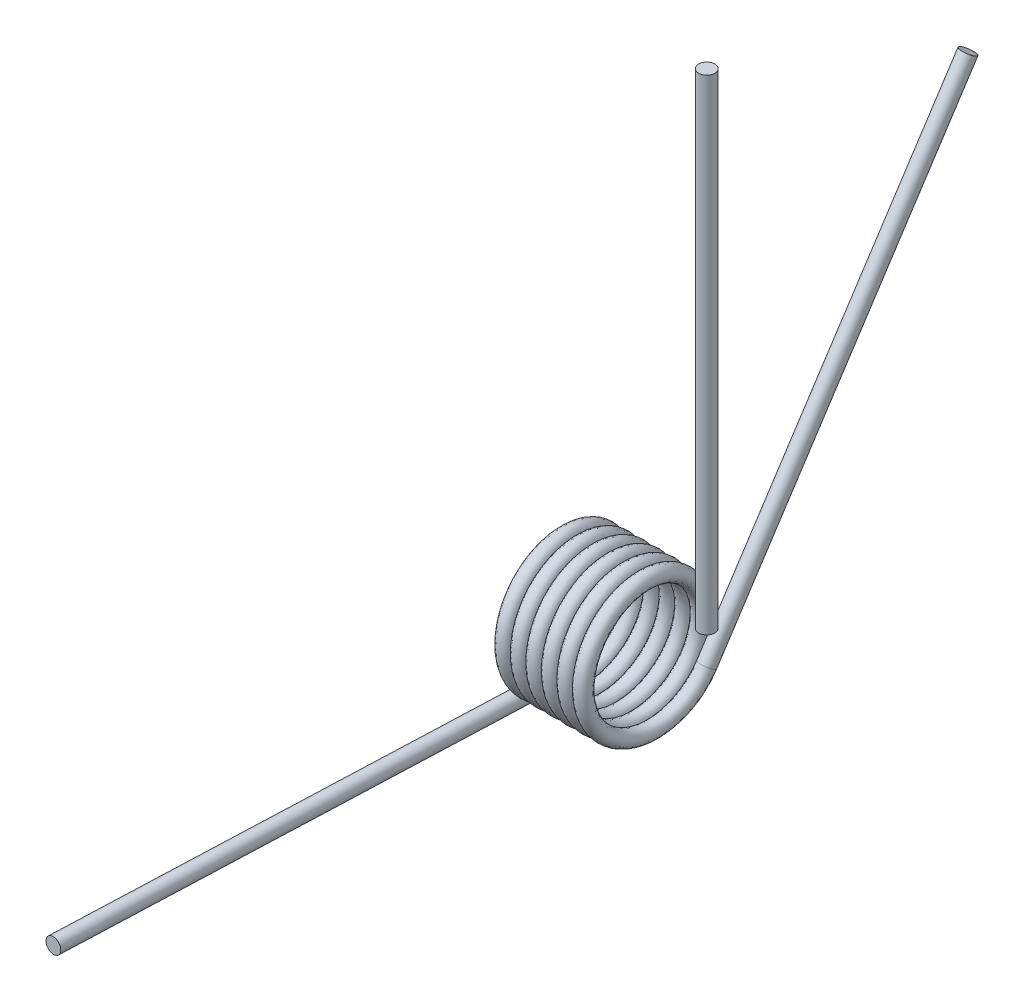
from build123d import *

# Parameters (mm, degrees)
SWEEP1_PITCH        = 2.4384
SKETCH4_R           = 1.2065
EXTRUDE1_DEPTH      = 76.2
SKETCH5_R           = 1.2065
EXTRUDE2_DEPTH      = 76.2
SKETCH7_R           = 1.27
BOSS_EXTRUDE1_DEPTH = 76.2


with BuildPart() as part:
    # Sweep1: the profile of Sketch3 screwed along a right-hand helix of 6.166667 turns, 6 arcs to a turn; built about Z, then put on its axis
    sweep1_z = Axis((0, 0, 0), (0, 0, 1))
    sweep1_corners = [(9.88323439, -0.047460601, 1.205240148), (11.061374251, 0.001103098, -0.028012679), (9.82716561, 0.047460601, -1.205240148), (8.649025749, -0.001103098, 0.028012679)]
    with BuildLine(mode=Mode.PRIVATE) as sweep1_profile:
        ThreePointArc((9.88323439, -0.047460601, 1.205240148), (10.727917299, -0.032779704, 0.832425526), (11.061374251, 0.001103098, -0.028012679))
        ThreePointArc((11.061374251, 0.001103098, -0.028012679), (10.688270685, 0.034339721, -0.872041437), (9.82716561, 0.047460601, -1.205240148))
        ThreePointArc((9.82716561, 0.047460601, -1.205240148), (8.982482701, 0.032779704, -0.832425526), (8.649025749, -0.001103098, 0.028012679))
        ThreePointArc((8.649025749, -0.001103098, 0.028012679), (9.022129315, -0.034339721, 0.872041437), (9.88323439, -0.047460601, 1.205240148))
    sweep1_cap = Face(sweep1_profile.wire())
    sweep1_arcs = [((9.88323439, -0.047460601, 1.205240148), (11.08940864, -0.046357502, 1.177227469), (11.061374251, 0.001103098, -0.028012679), (1, 0.7071067811865476, 1)), ((11.061374251, 0.001103098, -0.028012679), (11.033339861, 0.048563699, -1.233252827), (9.82716561, 0.047460601, -1.205240148), (1, 0.7071067811865476, 1)), ((9.82716561, 0.047460601, -1.205240148), (8.62099136, 0.046357502, -1.177227469), (8.649025749, -0.001103098, 0.028012679), (1, 0.7071067811865476, 1)), ((8.649025749, -0.001103098, 0.028012679), (8.677060139, -0.048563699, 1.233252827), (9.88323439, -0.047460601, 1.205240148), (1, 0.7071067811865476, 1))]  # start, shoulder, end, weights
    sweep1_turn_angles = [0, 30, 60, 90, 120, 150, 180, 210, 240, 270, 300, 330, 360]
    sweep1_turn_weights = [1, 0.8660254037844387, 1, 0.8660254037844387, 1, 0.8660254037844387, 1, 0.8660254037844387, 1, 0.8660254037844387, 1, 0.8660254037844387, 1]
    sweep1_turn_sides = [Face.make_bezier_surface([[Vector(p[j][0], p[j][1], 0).rotate(sweep1_z, sweep1_turn_angles[2 * i + k]) / sweep1_turn_weights[2 * i + k] + Vector(0, 0, p[j][2] + SWEEP1_PITCH * sweep1_turn_angles[2 * i + k] / 360) for k in range(3)] for j in range(3)], [[p[3][j] * sweep1_turn_weights[2 * i + k] for k in range(3)] for j in range(3)]) for p in sweep1_arcs for i in range(6)]
    sweep1_last_angles = [2160, 2190, 2220]
    sweep1_last_weights = [1, 0.866025403784403, 1]
    sweep1_last_sides = [Face.make_bezier_surface([[Vector(p[j][0], p[j][1], 0).rotate(sweep1_z, sweep1_last_angles[2 * i + k]) / sweep1_last_weights[2 * i + k] + Vector(0, 0, p[j][2] + SWEEP1_PITCH * sweep1_last_angles[2 * i + k] / 360) for k in range(3)] for j in range(3)], [[p[3][j] * sweep1_last_weights[2 * i + k] for k in range(3)] for j in range(3)]) for p in sweep1_arcs for i in range(1)]
    sweep1 = Plane(origin=(0, 0, 0), x_dir=(0, -1, 0), z_dir=(1, 0, 0)) * Solid(Shell([*[p.moved(Location((0, 0, SWEEP1_PITCH * i))) for i in range(6) for p in sweep1_turn_sides], *sweep1_last_sides, sweep1_cap, sweep1_cap.rotate(sweep1_z, 2220).moved(Location((0, 0, SWEEP1_PITCH * 2220 / 360)))]))
    add(sweep1)

    # Sketch4 → Extrude1 (add)
    with BuildSketch(Plane(origin=(0, 0, 0), x_dir=(-0.9989557795402644, 0.02323612909274865, -0.03933742274079572), z_dir=(-0.03934804652827867, -1.074661193367632e-14, 0.9992255657429951))):
        with Locations(Location((-0.228996699, 9.852539142, 0), (0, 0, 181.33145196))):
            Circle(SKETCH4_R)
    extrude(amount=EXTRUDE1_DEPTH)

    # Sketch5 → Extrude2 (add)
    with BuildSketch(Plane(origin=(0.023281008, 0.51200331, -0.295605249), x_dir=(0.9981783086806318, -0.05692649144876503, -0.019985961343079544), z_dir=(0.03934804652827868, 0.8653547240443688, -0.49961278287139826))):
        with Locations(Location((15.460495825, 9.15714575, 0), (0, 0, 177.376564152))):
            Circle(SKETCH5_R)
    extrude(amount=EXTRUDE2_DEPTH)

    # Sketch7 → Boss-Extrude1 (add)
    with BuildSketch(Plane(origin=(0, 0, 0), x_dir=(1, 0, 0), z_dir=(0, 1, 0))):
        with Locations(Location((15.0368, 8.534853559, 0), (0, 0, 270))):
            Circle(SKETCH7_R)
    extrude(amount=BOSS_EXTRUDE1_DEPTH)


solid = part.part
